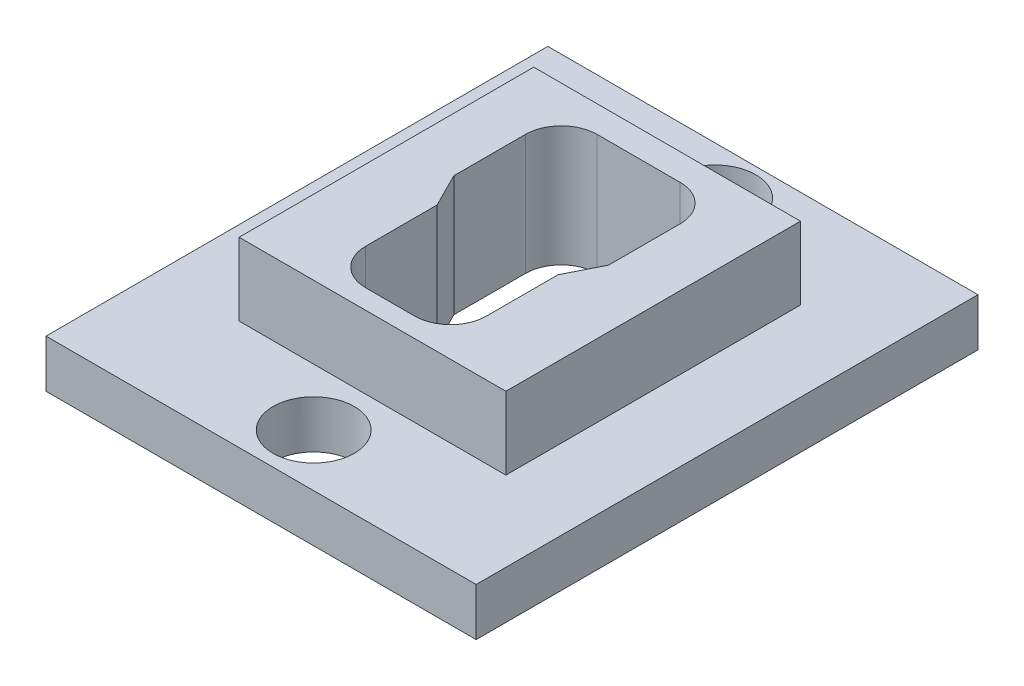
from build123d import *

# Parameters (mm, degrees)
SKETCH1_W               = 22.86
SKETCH1_H               = 26.67
BOSS_EXTRUDE2_DEPTH     = 6.4008
CUT_EXTRUDE2_DEPTH      = 19.784051337
CUT_EXTRUDE2_DEPTH_BACK = 19.784051337
SKETCH4_R               = 2.159
SKETCH5_W               = 22.86
SKETCH5_H               = 26.67
SKETCH5_W_2             = 14.176500573
SKETCH5_H_2             = 15.654948519
CUT_EXTRUDE3_DEPTH      = 3.8608


with BuildPart() as part:
    # Sketch1 → Boss-Extrude2 (new body)
    with BuildSketch(Plane(origin=(0, 0, 0), x_dir=(1, 0, 0), z_dir=(0, 1, 0))):
        with Locations((0, -0.127)):
            Rectangle(SKETCH1_W, SKETCH1_H)
        with BuildLine():
            Line((2.208651403, 6.604), (-2.208651403, 6.604))
            ThreePointArc((-2.208651403, 6.604), (-3.555689822, 6.046038418), (-4.113651403, 4.699))
            Line((-4.113651403, 4.699), (-4.113651403, 0.89281026))
            Line((-4.113651403, 0.89281026), (-3.2131, -0.89281026))
            Line((-3.2131, -0.89281026), (-3.2131, -4.699))
            ThreePointArc((-3.2131, -4.699), (-2.655138418, -6.046038418), (-1.3081, -6.604))
            Line((-1.3081, -6.604), (0, -6.604))
            Line((0, -6.604), (1.3081, -6.604))
            ThreePointArc((1.3081, -6.604), (2.655138418, -6.046038418), (3.2131, -4.699))
            Line((3.2131, -4.699), (3.2131, -0.89281026))
            Line((3.2131, -0.89281026), (4.113651403, 0.89281026))
            Line((4.113651403, 0.89281026), (4.113651403, 4.699))
            ThreePointArc((4.113651403, 4.699), (3.555689822, 6.046038418), (2.208651403, 6.604))
        make_face(mode=Mode.SUBTRACT)
    extrude(amount=BOSS_EXTRUDE2_DEPTH)

    # Sketch4 → Cut-Extrude2 (cut, two sides: drawn at the far end of the back side and taken through both)
    with BuildSketch(Plane(origin=(0, 6.4008, 0), x_dir=(1, 0, 0), z_dir=(0, 1, 0)).offset(-CUT_EXTRUDE2_DEPTH_BACK)):
        with Locations((0, 10.668)):
            Circle(SKETCH4_R)
        with Locations((0, -10.668)):
            Circle(SKETCH4_R)
    extrude(amount=CUT_EXTRUDE2_DEPTH + CUT_EXTRUDE2_DEPTH_BACK, mode=Mode.SUBTRACT)

    # Sketch5 → Cut-Extrude3 (cut)
    with BuildSketch(Plane(origin=(0, 6.4008, 0), x_dir=(1, 0, 0), z_dir=(0, 1, 0))):
        with Locations((0, -0.127)):
            Rectangle(SKETCH5_W, SKETCH5_H)
        with Locations((0.100607395, 0.186968005)):
            Rectangle(SKETCH5_W_2, SKETCH5_H_2, mode=Mode.SUBTRACT)
    extrude(amount=-CUT_EXTRUDE3_DEPTH, mode=Mode.SUBTRACT)


solid = part.part
